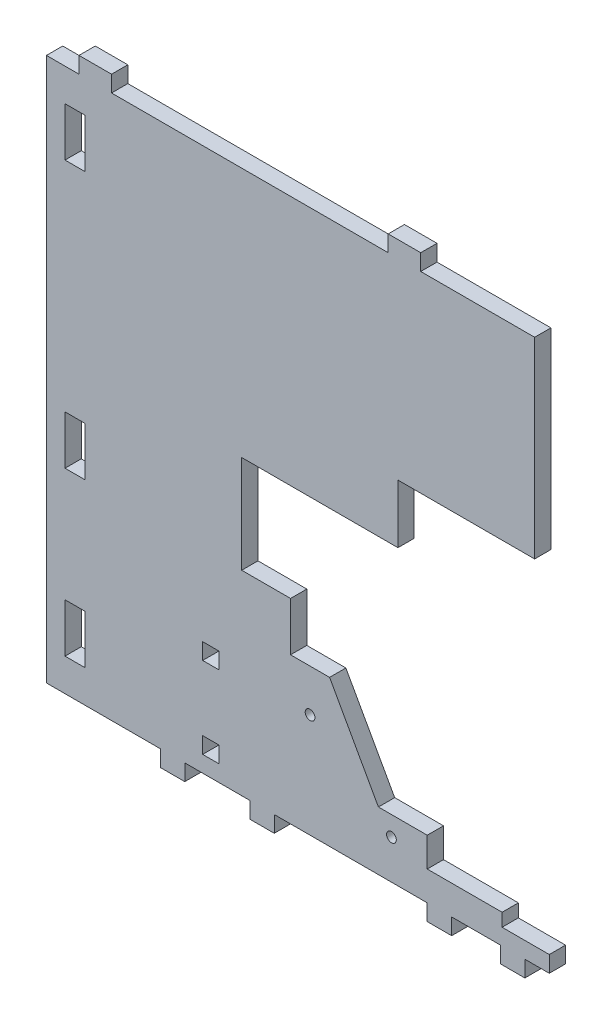
from build123d import *

# Parameters (mm, degrees)
ESQUISSE1_R        = 1.5
BOSS_EXTRU_1_DEPTH = 5
ESQUISSE2_W        = 6.138933528
ESQUISSE2_H        = 15
ESQUISSE2_W_2      = 5
ESQUISSE2_H_2      = 5
BOSS_EXTRU_2_DEPTH = 5


with BuildPart() as part:
    # Esquisse1 → Boss.-Extru.1 (new body)
    with BuildSketch(Plane.XY):
        Polygon((0, 0), (37, 0), (37, 18), (27, 18), (12, 45), (0, 45), align=None)
        with Locations((6, 32)):
            Circle(ESQUISSE1_R, mode=Mode.SUBTRACT)
        with Locations((31, 12)):
            Circle(ESQUISSE1_R, mode=Mode.SUBTRACT)
    extrude(amount=BOSS_EXTRU_1_DEPTH)

    # Esquisse2 → Boss.-Extru.2 (add)
    # profile 1 of 2: a face of its own
    with BuildSketch(Plane.XY.offset(5)):
        Polygon((37, 18), (37, 0), (42, 0), (42, -5), (49.5, -5), (49.5, 0), (64.5, 0), (64.5, -5), (72, -5), (72, 0), (79.5, 0), (79.5, 5), (65, 5), (65, 9), (42, 9), (42, 18), align=None)
    # profile 2 of 2: a face of its own
    with BuildSketch(Plane.XY.offset(5)):
        Polygon((-5, 0), (0, 0), (0, 60), (-15, 60), (-15, 90), (33, 90), (33, 108), (75, 108), (75, 167), (40, 167), (40, 172), (30, 172), (30, 167), (-55, 167), (-55, 172), (-65, 172), (-65, 167), (-75, 167), (-75, 0), (-40, 0), (-40, -5), (-32.5, -5), (-32.5, 0), (-12.5, 0), (-12.5, -5), (-5, -5), align=None)
        with Locations((-66.228617731, 17.5)):
            Rectangle(ESQUISSE2_W, ESQUISSE2_H, mode=Mode.SUBTRACT)
        with Locations((-24.5, 7.5)):
            Rectangle(ESQUISSE2_W_2, ESQUISSE2_H_2, mode=Mode.SUBTRACT)
        with Locations((-24.5, 32.5)):
            Rectangle(ESQUISSE2_W_2, ESQUISSE2_H_2, mode=Mode.SUBTRACT)
        with Locations((-66.228617731, 67.5)):
            Rectangle(ESQUISSE2_W, ESQUISSE2_H, mode=Mode.SUBTRACT)
        with Locations((-66.228617731, 149.5)):
            Rectangle(ESQUISSE2_W, ESQUISSE2_H, mode=Mode.SUBTRACT)
    extrude(amount=-BOSS_EXTRU_2_DEPTH)


solid = part.part
